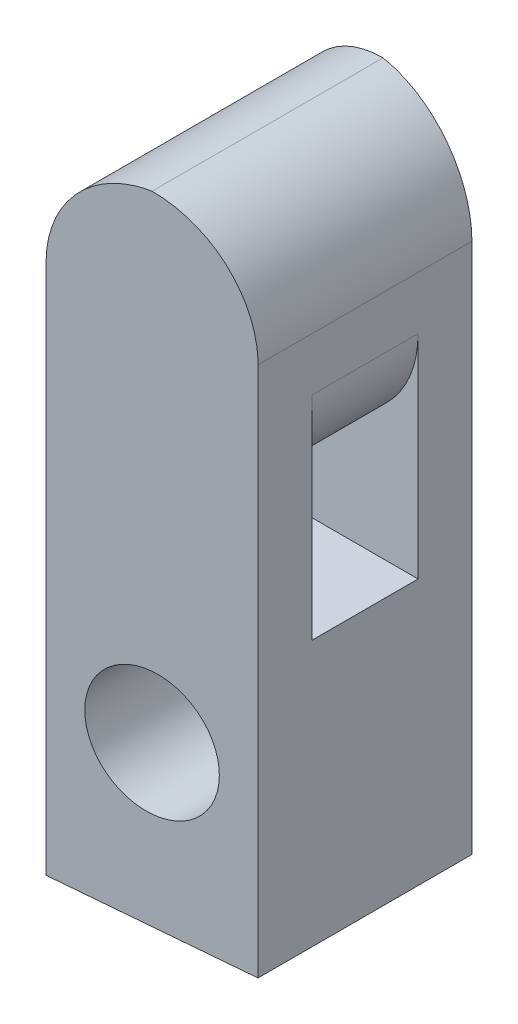
from build123d import *

# Parameters (mm, degrees)
BOSS_EXTRUDE1_DEPTH     = 10
BOSS_EXTRUDE2_DEPTH     = 2
SKETCH4_W               = 2
SKETCH4_H               = 2
CUT_EXTRUDE1_DEPTH      = 3.67
FILLET1_R               = 2
CUT_EXTRUDE2_DEPTH      = 13.355398317
CUT_EXTRUDE2_DEPTH_BACK = 13.355398317
SKETCH6_R               = 1.165


with BuildPart() as part:
    # Sketch2 → Boss-Extrude1 (new body)
    with BuildSketch(Plane(origin=(0, 0, 0), x_dir=(1, 0, 0), z_dir=(0, 1, 0))):
        Polygon((-1.835, -2.335), (-1.835, 2.335), (1.835, 2.013916605), (1.835, -2.013916605), align=None)
    extrude(amount=BOSS_EXTRUDE1_DEPTH)

    # Sketch3 → Boss-Extrude2 (add)
    with BuildSketch(Plane(origin=(0, 10, 0), x_dir=(1, 0, 0), z_dir=(0, 1, 0))):
        Polygon((1.835, -2.013916605), (1.835, 2.013916605), (-1.835, 2.335), (-1.835, -2.335), align=None)
    extrude(amount=BOSS_EXTRUDE2_DEPTH)

    # Sketch4 → Cut-Extrude1 (cut)
    with BuildSketch(Plane(origin=(1.835, 0, 0), x_dir=(0, 0, -1), z_dir=(1, 0, 0))):
        with Locations((0, 6)):
            Rectangle(SKETCH4_W, SKETCH4_H)
    extrude(amount=-CUT_EXTRUDE1_DEPTH, mode=Mode.SUBTRACT)

    # Fillet1
    # the kernel refuses this fillet: 2 mm, written as the material it takes off along each edge
    with BuildSketch(Plane(origin=(1.835, 12, 7.013916605), x_dir=(-1, 0, 0), z_dir=(0, 0, -1))) as fillet1_piece_1:
        with BuildLine():
            CenterArc((FILLET1_R, -FILLET1_R), FILLET1_R, 90, 90)
            Line((0, -FILLET1_R), (0, 0))
            Line((0, 0), (FILLET1_R, 0))
        make_face()
    extrude(amount=14.02783321, mode=Mode.SUBTRACT)
    with BuildSketch(Plane(origin=(-1.835, 12, -7.335), x_dir=(0, -1, 0), z_dir=(0, 0, 1))) as fillet1_piece_2:
        with BuildLine():
            CenterArc((FILLET1_R, FILLET1_R), FILLET1_R, 180, 90)
            Line((0, FILLET1_R), (0, 0))
            Line((0, 0), (FILLET1_R, 0))
        make_face()
    extrude(amount=14.67, mode=Mode.SUBTRACT)
    with BuildSketch(Plane(origin=(-1.835, 7, -1), x_dir=(0, 1, 0), z_dir=(0, 0, 1)), Plane(origin=(1.835, 7, -1), x_dir=(-1, 0, 0), z_dir=(0, 0, 1))) as fillet1_piece_3:
        with BuildLine():
            CenterArc((FILLET1_R, -FILLET1_R), FILLET1_R, 90, 90)
            Line((0, -FILLET1_R), (0, 0))
            Line((0, 0), (FILLET1_R, 0))
        make_face()
    extrude(amount=2, mode=Mode.SUBTRACT)

    # Sketch6 → Cut-Extrude2 (cut, two sides: drawn at the far end of the back side and taken through both)
    with BuildSketch(Plane.XY.offset(-CUT_EXTRUDE2_DEPTH_BACK)):
        with Locations((0, 3)):
            Circle(SKETCH6_R)
    extrude(amount=CUT_EXTRUDE2_DEPTH + CUT_EXTRUDE2_DEPTH_BACK, mode=Mode.SUBTRACT)


solid = part.part
